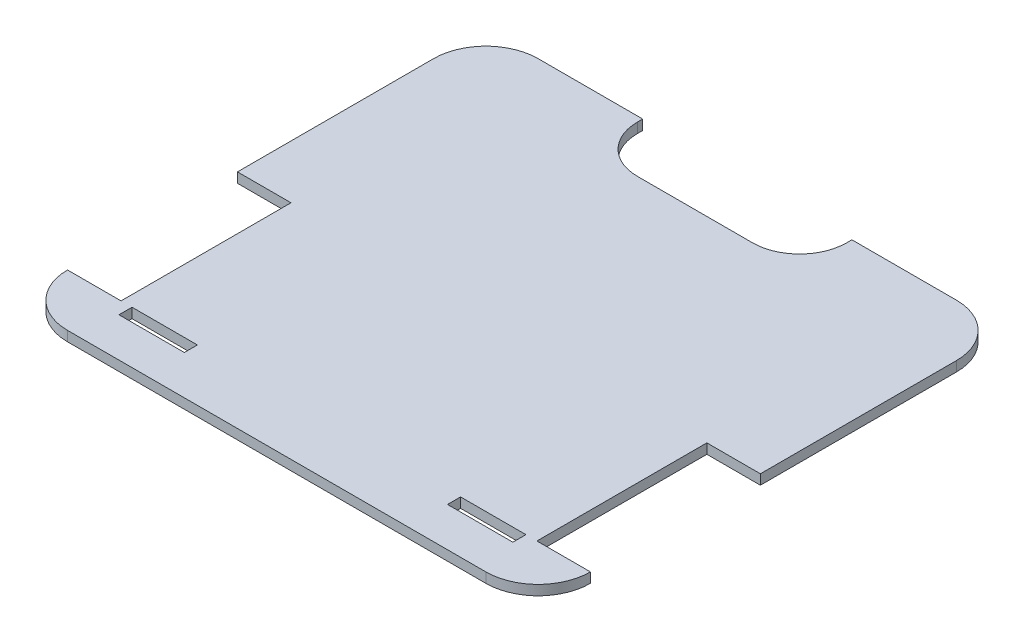
from build123d import *

# Parameters (mm, degrees)
SKETCH1_W           = 254
SKETCH1_H           = 228.6
BOSS_EXTRUDE1_DEPTH = 4.826
SKETCH2_W           = 26.00000007
SKETCH2_H           = 82.55
CUT_EXTRUDE1_DEPTH  = 4.826
CUT_EXTRUDE3_DEPTH  = 4.826
SKETCH7_W           = 101.6
SKETCH7_H           = 25.4
CUT_EXTRUDE5_DEPTH  = 4.826
FILLET9_R           = 22.86
FILLET10_R          = 22.86
CUT_EXTRUDE6_DEPTH  = 4.826
SKETCH9_W           = 31.75
SKETCH9_H           = 6.35
CUT_EXTRUDE7_DEPTH  = 171.929167423


with BuildPart() as part:
    # Sketch1 → Boss-Extrude1 (new body)
    with BuildSketch(Plane(origin=(0, 0, 0), x_dir=(1, 0, 0), z_dir=(0, 1, 0))):
        Rectangle(SKETCH1_W, SKETCH1_H)
    extrude(amount=BOSS_EXTRUDE1_DEPTH)

    # Sketch2 → Cut-Extrude1 (cut)
    with BuildSketch(Plane(origin=(0, 4.826, 0), x_dir=(1, 0, 0), z_dir=(0, 1, 0))):
        with Locations((-113.999999965, -47.625)):
            Rectangle(SKETCH2_W, SKETCH2_H)
        with Locations((113.999999965, -47.625)):
            Rectangle(SKETCH2_W, SKETCH2_H)
    extrude(amount=-CUT_EXTRUDE1_DEPTH, mode=Mode.SUBTRACT)

    # Sketch4 → Cut-Extrude3 (cut)
    with BuildSketch(Plane(origin=(0, 4.826, 0), x_dir=(1, 0, 0), z_dir=(0, 1, 0))):
        with BuildLine():
            Line((-127, 88.9), (-127, 114.3))
            Line((-127, 114.3), (-101.6, 114.3))
            ThreePointArc((-101.6, 114.3), (-119.560512242, 106.860512242), (-127, 88.9))
        make_face()
        with BuildLine():
            Line((127, 88.9), (127, 114.3))
            Line((127, 114.3), (101.6, 114.3))
            ThreePointArc((101.6, 114.3), (119.560512242, 106.860512242), (127, 88.9))
        make_face()
    extrude(amount=-CUT_EXTRUDE3_DEPTH, mode=Mode.SUBTRACT)

    # Sketch7 → Cut-Extrude5 (cut)
    with BuildSketch(Plane(origin=(0, 4.826, 0), x_dir=(1, 0, 0), z_dir=(0, 1, 0))):
        with Locations((0, 101.6)):
            Rectangle(SKETCH7_W, SKETCH7_H)
    extrude(amount=-CUT_EXTRUDE5_DEPTH, mode=Mode.SUBTRACT)

    # Fillet9
    fillet9_edges = [part.edges().sort_by_distance(p)[0] for p in [
        (-50.8, 2.413, -88.9),
    ]]
    fillet(fillet9_edges, radius=FILLET9_R)

    # Fillet10
    fillet10_edges = [part.edges().sort_by_distance(p)[0] for p in [
        (50.8, 2.413, -88.9),
    ]]
    fillet(fillet10_edges, radius=FILLET10_R)

    # Sketch8 → Cut-Extrude6 (cut)
    with BuildSketch(Plane(origin=(0, 4.826, 0), x_dir=(1, 0, 0), z_dir=(0, 1, 0))):
        with BuildLine():
            Line((-127, -88.9), (-127, -114.3))
            Line((-127, -114.3), (-101.6, -114.3))
            ThreePointArc((-101.6, -114.3), (-119.560512242, -106.860512242), (-127, -88.9))
        make_face()
        with BuildLine():
            Line((127, -114.3), (101.6, -114.3))
            ThreePointArc((101.6, -114.3), (119.560512242, -106.860512242), (127, -88.9))
            Line((127, -88.9), (127, -114.3))
        make_face()
    extrude(amount=-CUT_EXTRUDE6_DEPTH, mode=Mode.SUBTRACT)

    # Sketch9 → Cut-Extrude7 (cut, through all)
    with BuildSketch(Plane.XZ):
        with Locations((-79.79099993, 92.075)):
            Rectangle(SKETCH9_W, SKETCH9_H)
        with Locations((79.79099993, 92.075)):
            Rectangle(SKETCH9_W, SKETCH9_H)
    extrude(amount=-CUT_EXTRUDE7_DEPTH, mode=Mode.SUBTRACT)


solid = part.part
